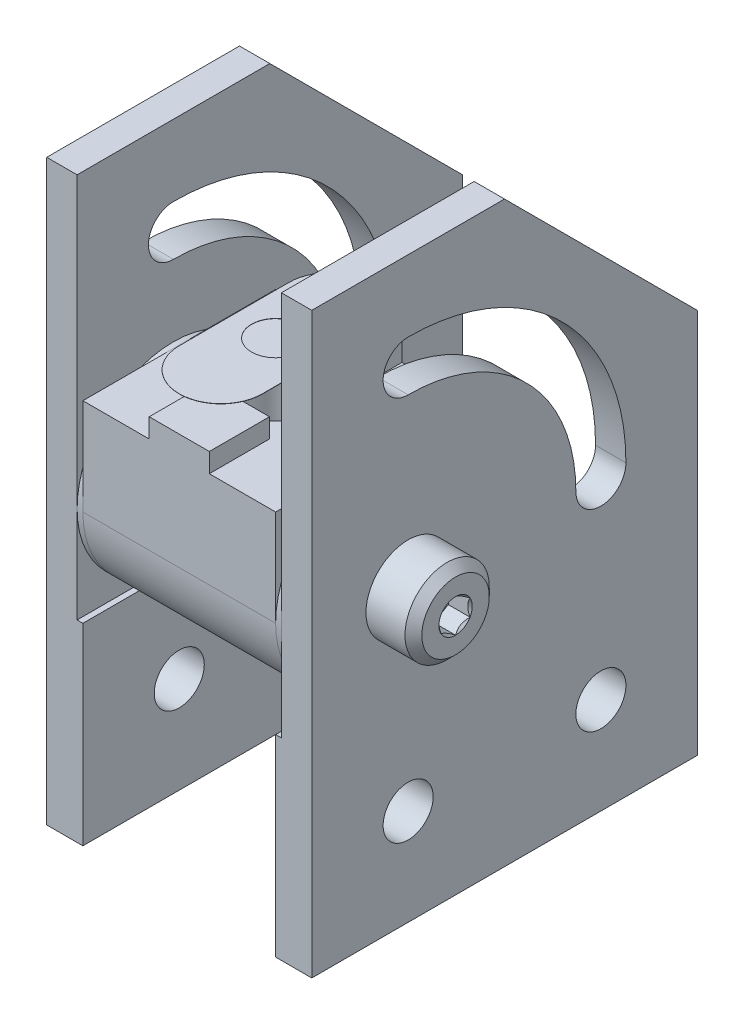
from build123d import *

# Parameters (mm, degrees)
SKETCH2_R               = 3.175
BOSS_EXTRUDE1_DEPTH     = 12.7
SKETCH3_W               = 7.9248
SKETCH3_H               = 2.54
BOSS_EXTRUDE2_DEPTH     = 3.9624
SKETCH37_R              = 12.7
SKETCH37_R_2            = 4.7625
BOSS_EXTRUDE11_DEPTH    = 0.762
SKETCH23_R              = 3.29819
SKETCH23_R_2            = 4.7625
BOSS_EXTRUDE8_DEPTH     = 4.7625
CUT_EXTRUDE9_DEPTH      = 84.173486799
CUT_EXTRUDE9_DEPTH_BACK = 84.173486799
SKETCH36_W              = 0.762
SKETCH36_H              = 50.8
CUT_EXTRUDE1_DEPTH      = 2.8575
SKETCH12_R              = 5.191125
CUT_EXTRUDE3_DEPTH      = 81.624592668
SKETCH13_R              = 3.29819
CUT_EXTRUDE4_DEPTH      = 81.624592668
SKETCH14_R              = 3.175
BOSS_EXTRUDE6_DEPTH     = 0.0254
SKETCH16_R              = 3.175
BOSS_EXTRUDE7_DEPTH     = 1.27
CUT_EXTRUDE5_DEPTH      = 2.8575
BODY_MOVE_COPY1_ANGLE   = 180
CUT_SWEEP11_PITCH       = 1.27
CUT_SWEEP11_FROM        = 0
SKETCH56_W              = 25.4
SKETCH56_H              = 50.8
CUT_EXTRUDE12_DEPTH     = 92.148992685


with BuildPart() as part:
    # Sketch2 → Boss-Extrude1 (new, symmetric)
    with BuildSketch(Plane(origin=(0, 0, 0), x_dir=(0, 0, -1), z_dir=(1, 0, 0))):
        with BuildLine():
            ThreePointArc((-12.7, 12.7), (0, 25.4), (12.7, 12.7))
            Line((12.7, 12.7), (12.7, 0))
            Line((12.7, 0), (-12.7, 0))
            Line((-12.7, 0), (-12.7, 12.7))
        make_face()
        with Locations((0, 12.7)):
            Circle(SKETCH2_R, mode=Mode.SUBTRACT)
    extrude(amount=BOSS_EXTRUDE1_DEPTH, both=True)

    # Sketch3 → Boss-Extrude2 (add, symmetric)
    with BuildSketch(Plane(origin=(0, 0, 0), x_dir=(0, 0, -1), z_dir=(1, 0, 0))):
        with Locations((8.7376, -1.27)):
            Rectangle(SKETCH3_W, SKETCH3_H)
        with Locations((-8.7376, -1.27)):
            Rectangle(SKETCH3_W, SKETCH3_H)
    extrude(amount=BOSS_EXTRUDE2_DEPTH, both=True)

    # Sketch12 → Cut-Extrude3 (cut, through all)
    with BuildSketch(Plane(origin=(0, 18.25625, 0), x_dir=(1, 0, 0), z_dir=(0, 1, 0))):
        with Locations(Location((0, 0, 0), (0, 0, 90))):
            Circle(SKETCH12_R)
    extrude(amount=CUT_EXTRUDE3_DEPTH, mode=Mode.SUBTRACT)

    # Sketch13 → Cut-Extrude4 (cut, through all)
    with BuildSketch(Plane(origin=(0, 18.25625, 0), x_dir=(1, 0, 0), z_dir=(0, 1, 0))):
        with Locations(Location((0, 0, 0), (0, 0, 270))):
            Circle(SKETCH13_R)
    extrude(amount=-CUT_EXTRUDE4_DEPTH, mode=Mode.SUBTRACT)


with BuildPart() as body_2:
    # Sketch37 → Boss-Extrude11 (new body)
    with BuildSketch(Plane.ZY.offset(12.7)):
        with Locations(Location((0, 12.7, 0), (0, 0, 180))):
            Circle(SKETCH37_R)
        with Locations(Location((0, 12.7, 0), (0, 0, 180))):
            Circle(SKETCH37_R_2, mode=Mode.SUBTRACT)
    extrude(amount=BOSS_EXTRUDE11_DEPTH)


with BuildPart() as body_3:
    # Sketch23 → Boss-Extrude8 (new body)
    with BuildSketch(Plane(origin=(-12.7, 0, 0), x_dir=(0, 0, -1), z_dir=(1, 0, 0))):
        Polygon((-12.7, 50.8), (-12.7, -25.4), (63.5, -25.4), (63.5, 0), (12.7, 50.8), align=None)
        with Locations((0, -12.7)):
            Circle(SKETCH23_R, mode=Mode.SUBTRACT)
        with Locations((25.4, -12.7)):
            Circle(SKETCH23_R, mode=Mode.SUBTRACT)
        with Locations((50.8, -12.7)):
            Circle(SKETCH23_R, mode=Mode.SUBTRACT)
        with Locations((0, 12.7)):
            Circle(SKETCH23_R_2, mode=Mode.SUBTRACT)
        with BuildLine():
            ThreePointArc((28.69819, 12.7), (20.292684757, 32.992684757), (0, 41.39819))
            ThreePointArc((0, 41.39819), (-3.29819, 38.1), (0, 34.80181))
            ThreePointArc((0, 34.80181), (15.628339727, 28.328339727), (22.10181, 12.7))
            ThreePointArc((22.10181, 12.7), (25.4, 9.40181), (28.69819, 12.7))
        make_face(mode=Mode.SUBTRACT)
    extrude(amount=-BOSS_EXTRUDE8_DEPTH)

    # Sketch36 → Cut-Extrude9 (cut, two sides: drawn at the far end of the back side and taken through both)
    with BuildSketch(Plane.XY.offset(-CUT_EXTRUDE9_DEPTH_BACK)):
        with Locations((-13.081, 25.4)):
            Rectangle(SKETCH36_W, SKETCH36_H)
    extrude(amount=CUT_EXTRUDE9_DEPTH + CUT_EXTRUDE9_DEPTH_BACK, mode=Mode.SUBTRACT)


with BuildPart() as body_4:
    # Sketch8 → Revolve1 (revolve)
    with BuildSketch(Plane.XY, mode=Mode.PRIVATE) as revolve1_sk:
        Polygon((-22.59965, 18.25625), (-17.4625, 18.25625), (-17.4625, 17.4625), (-12.7, 17.4625), (-12.7, 15.875), (-6.35, 15.875), (-6.35, 12.7), (-23.7109, 12.7), (-23.7109, 17.145), align=None)
    revolve(revolve1_sk.sketch.rotate(Axis((-23.7109, 12.7, 0), (1, 0, 0)), 90), axis=Axis((-23.7109, 12.7, 0), (1, 0, 0)))

    # Sketch9 → Cut-Extrude1 (cut)
    with BuildSketch(Plane.ZY.offset(23.7109)):
        Polygon((0, 14.899704526), (-1.905, 13.799852263), (-1.905, 11.600147737), (0, 10.500295474), (1.905, 11.600147737), (1.905, 13.799852263), align=None)
    extrude(amount=-CUT_EXTRUDE1_DEPTH, mode=Mode.SUBTRACT)

    # Cut-Extrude2 cone 1 section (through the dimple's axis) → Cut-Extrude2 (revolve, cut)
    with BuildSketch(Plane(origin=(-23.7109, 12.7, 0), x_dir=(0, 0, 1), z_dir=(0, 1, 0))):
        Polygon((0, 0), (2.199704526, 0), (0, 2.199704526), align=None)
    revolve(axis=Axis((-23.7109, 12.7, 0), (1, 0, 0)), mode=Mode.SUBTRACT)


with BuildPart() as body_5:
    # Mirror2: mirrored copy
    add(body_4.part.mirror(Plane(origin=(0, 0, 0), x_dir=(0, 0, 1), z_dir=(1, 0, 0))))


with BuildPart() as body_6:
    # Mirror2 2: mirrored copy
    add(body_3.part.mirror(Plane(origin=(0, 0, 0), x_dir=(0, 0, 1), z_dir=(1, 0, 0))))


with BuildPart() as body_7:
    # Mirror2 3: mirrored copy
    add(body_2.part.mirror(Plane(origin=(0, 0, 0), x_dir=(0, 0, 1), z_dir=(1, 0, 0))))


with BuildPart() as body_8:
    # Sketch14 → Boss-Extrude6 (new body)
    with BuildSketch(Plane(origin=(0, -7.14375, 0), x_dir=(1, 0, 0), z_dir=(0, 1, 0))):
        with BuildLine():
            Line((5.476875, 7.223125), (5.476875, -7.223125))
            ThreePointArc((5.476875, -7.223125), (0, -12.7), (-5.476875, -7.223125))
            Line((-5.476875, -7.223125), (-5.476875, 7.223125))
            ThreePointArc((-5.476875, 7.223125), (0, 12.7), (5.476875, 7.223125))
        make_face()
        with Locations(Location((0, 0, 0), (0, 0, 270))):
            Circle(SKETCH14_R, mode=Mode.SUBTRACT)
    extrude(amount=BOSS_EXTRUDE6_DEPTH)


with BuildPart() as body_9:
    # Sketch16 → Boss-Extrude7 (new body)
    with BuildSketch(Plane(origin=(0, 18.25625, 0), x_dir=(1, 0, 0), z_dir=(0, 1, 0))):
        with Locations(Location((0, 0, 0), (0, 0, 270))):
            Circle(SKETCH16_R)
    extrude(amount=-BOSS_EXTRUDE7_DEPTH)

    # Sketch19 → Revolve3 (revolve)
    with BuildSketch(Plane(origin=(0, 0, 0), x_dir=(0, 0, -1), z_dir=(1, 0, 0)), mode=Mode.PRIVATE) as revolve3_sk:
        Polygon((0, 18.25625), (0, 24.60625), (3.81, 24.60625), (4.7625, 23.65375), (4.7625, 18.25625), align=None)
    revolve(revolve3_sk.sketch.rotate(Axis((0, 25.4, 0), (0, -1, 0)), 180), axis=Axis((0, 25.4, 0), (0, -1, 0)))

    # Sketch20 → Cut-Extrude5 (cut)
    with BuildSketch(Plane(origin=(0, 24.60625, 0), x_dir=(1, 0, 0), z_dir=(0, 1, 0))):
        Polygon((1.099852263, 1.905), (-1.099852263, 1.905), (-2.199704526, 0), (-1.099852263, -1.905), (1.099852263, -1.905), (2.199704526, 0), align=None)
    extrude(amount=-CUT_EXTRUDE5_DEPTH, mode=Mode.SUBTRACT)

    # Cut-Extrude6 cone 1 section (through the dimple's axis) → Cut-Extrude6 (revolve, cut)
    with BuildSketch(Plane(origin=(0, 24.60625, 0), x_dir=(0, 0, 1), z_dir=(1, 0, 0))):
        Polygon((0, 0), (2.199704526, 0), (0, 2.199704526), align=None)
    revolve(axis=Axis((0, 24.60625, 0), (0, -1, 0)), mode=Mode.SUBTRACT)


with BuildPart() as part_1:
    # Body-Move/Copy1: moved
    add(part.part.rotate(Axis((0, 12.7, 0), (1, 0, 0)), BODY_MOVE_COPY1_ANGLE))


with BuildPart() as body_9_1:
    # Body-Move/Copy1: moved
    add(body_9.part.rotate(Axis((0, 12.7, 0), (1, 0, 0)), BODY_MOVE_COPY1_ANGLE))


with BuildPart() as body_8_1:
    # Body-Move/Copy1: moved
    add(body_8.part.rotate(Axis((0, 12.7, 0), (1, 0, 0)), BODY_MOVE_COPY1_ANGLE))


with BuildPart() as body_10:
    # Split1: read off the stored shape, not the designer's step
    # Split1: the piece on the far side of the plane
    add(body_9_1.part)
    split(bisect_by=Plane(origin=(0, 7.14375, 0), x_dir=(1, 0, 0), z_dir=(0, 1, 0)), keep=Keep.BOTTOM)


with BuildPart() as body_9_2:
    add(body_9_1.part)

    # Split1
    split(bisect_by=Plane(origin=(0, 7.14375, 0), x_dir=(1, 0, 0), z_dir=(0, 1, 0)), keep=Keep.TOP)

    # Cut-Sweep11: arcs per turn and ends read off the stored shape
    # Cut-Sweep11: the profile of Sketch53 screwed along a right-hand helix through 21 turns, 8 arcs to a turn; built about Z, then put on its axis
    cut_sweep11_z = Axis((0, 0, 0), (0, 0, 1))
    cut_sweep11_corners = [(2.350110803, 2.871e-06, -1.111249753), (2.350110803, 2.871e-06, -1.269999753), (1.525221606, 1.863e-06, -1.746249753), (1.497725299, 1.83e-06, -1.762124753), (1.497725299, 1.83e-06, -0.619124753), (1.525221606, 1.863e-06, -0.634999753)]
    with BuildLine(mode=Mode.PRIVATE) as cut_sweep11_profile:
        Line(cut_sweep11_corners[0], cut_sweep11_corners[1])
        Line(cut_sweep11_corners[1], cut_sweep11_corners[2])
        Line(cut_sweep11_corners[2], cut_sweep11_corners[3])
        Line(cut_sweep11_corners[3], cut_sweep11_corners[4])
        Line(cut_sweep11_corners[4], cut_sweep11_corners[5])
        Line(cut_sweep11_corners[5], cut_sweep11_corners[0])
    cut_sweep11_cap = Face(cut_sweep11_profile.wire())
    cut_sweep11_turn_angles = [0, 22.5, 45, 67.5, 90, 112.5, 135, 157.5, 180, 202.5, 225, 247.5, 270, 292.5, 315, 337.5, 360]
    cut_sweep11_turn_weights = [1, 0.9238795325112867, 1, 0.9238795325112867, 1, 0.9238795325112867, 1, 0.9238795325112867, 1, 0.9238795325112867, 1, 0.9238795325112867, 1, 0.9238795325112867, 1, 0.9238795325112867, 1]
    cut_sweep11_turn_rails = [Edge.make_bspline([Vector(p[0], p[1], 0).rotate(cut_sweep11_z, cut_sweep11_turn_angles[k]) / cut_sweep11_turn_weights[k] + Vector(0, 0, p[2] + CUT_SWEEP11_PITCH * cut_sweep11_turn_angles[k] / 360) for k in range(17)], [0, 0, 0, 1, 1, 2, 2, 3, 3, 4, 4, 5, 5, 6, 6, 7, 7, 8, 8, 8], 2, cut_sweep11_turn_weights) for p in cut_sweep11_corners]
    cut_sweep11_turn_sides = [Face.make_surface_from_curves(cut_sweep11_turn_rails[p[0]], cut_sweep11_turn_rails[p[1]]) for p in [(0, 1), (1, 2), (2, 3), (3, 4), (4, 5), (5, 0)]]
    cut_sweep11 = Plane(origin=(0, 7.14375, 0), x_dir=(0, 0, -1), z_dir=(0, 1, 0)) * split(Solid(Shell([*[p.moved(Location((0, 0, CUT_SWEEP11_PITCH * i))) for i in range(21) for p in cut_sweep11_turn_sides], cut_sweep11_cap, cut_sweep11_cap.rotate(cut_sweep11_z, 7560).moved(Location((0, 0, CUT_SWEEP11_PITCH * 7560 / 360)))])), bisect_by=Plane.XY.offset(CUT_SWEEP11_FROM), keep=Keep.TOP, mode=Mode.PRIVATE)
    add(cut_sweep11, mode=Mode.SUBTRACT)

    # Combine1: union body 10
    add(body_10.part)


with BuildPart() as cut_extrude12_tool:
    # Sketch56 → Cut-Extrude12 (new, through all)
    with BuildSketch(Plane(origin=(17.4625, 0, 0), x_dir=(0, 0, -1), z_dir=(1, 0, 0))):
        with Locations((50.8, 0)):
            Rectangle(SKETCH56_W, SKETCH56_H)
    extrude(amount=-CUT_EXTRUDE12_DEPTH)


with BuildPart() as body_3_1:
    add(body_3.part)

    # Cut-Extrude12: cut by cut_extrude12_tool
    add(cut_extrude12_tool.part, mode=Mode.SUBTRACT)


with BuildPart() as body_6_1:
    add(body_6.part)

    # Cut-Extrude12: cut by cut_extrude12_tool
    add(cut_extrude12_tool.part, mode=Mode.SUBTRACT)


solid = Compound([body_2.part, body_4.part, body_5.part, body_7.part, part_1.part, body_8_1.part, body_9_2.part, body_3_1.part, body_6_1.part])
